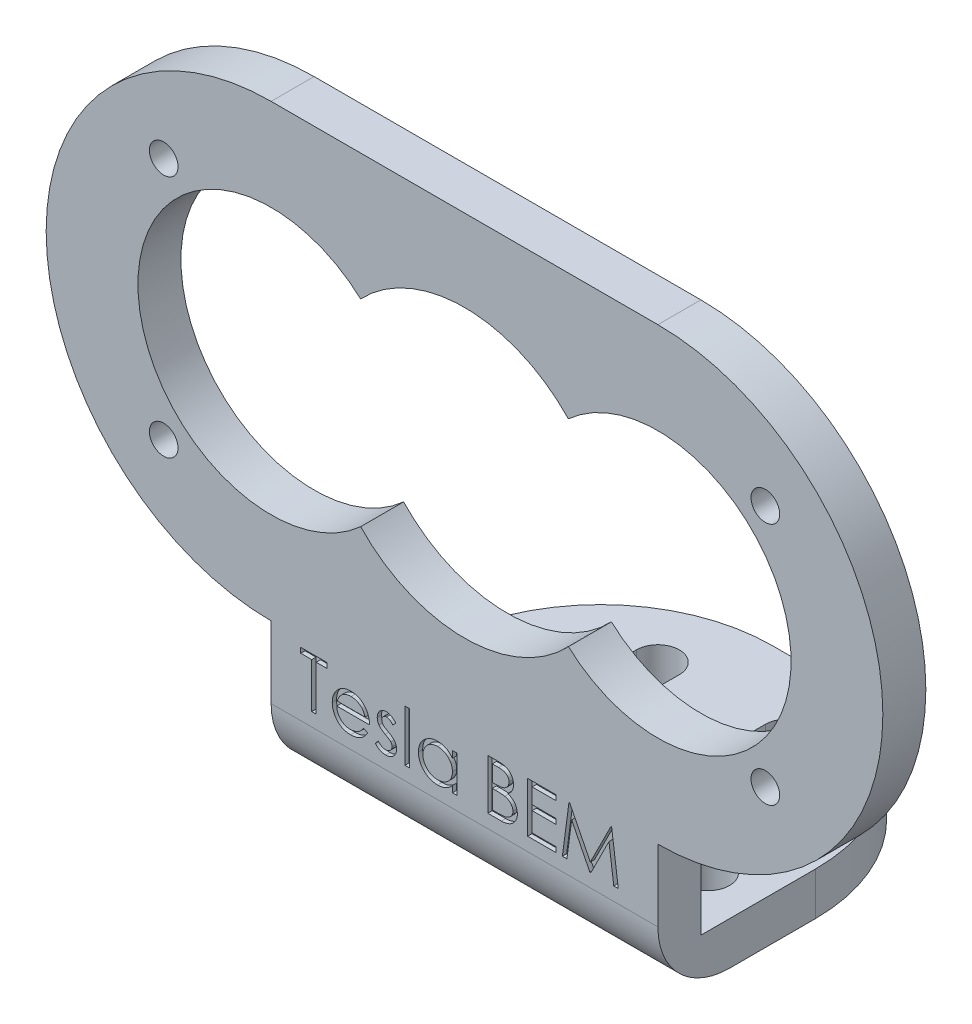
from build123d import *

# Parameters (mm, degrees)
CROQUIS1_R              = 1
SALIENTE_EXTRUIR1_DEPTH = 3
CROQUIS2_W              = 27
CROQUIS2_H              = 3
SALIENTE_EXTRUIR2_DEPTH = 20
REDONDEO1_R             = 12
CROQUIS3_R              = 1.5
CORTAR_EXTRUIR1_DEPTH   = 20
CROQUIS4_W              = 0.314102564
CROQUIS4_H              = 3.589743589
CORTAR_EXTRUIR2_DEPTH   = 0.3
REDONDEO2_R             = 5


with BuildPart() as part:
    # Croquis1 → Saliente-Extruir1 (new body)
    with BuildSketch(Plane.XY):
        with BuildLine():
            Line((0, -15.704277965), (0, -25.704277965))
            Line((0, -25.704277965), (27, -25.704277965))
            Line((27, -25.704277965), (27, -15.704277965))
            ThreePointArc((27, -15.704277965), (42.704277965, 0), (27, 15.704277965))
            Line((27, 15.704277965), (0, 15.704277965))
            ThreePointArc((0, 15.704277965), (-15.704277965, 0), (0, -15.704277965))
        make_face()
        with Locations((-7.5, 8.5)):
            Circle(CROQUIS1_R, mode=Mode.SUBTRACT)
        with Locations((34.5, 8.5)):
            Circle(CROQUIS1_R, mode=Mode.SUBTRACT)
        with Locations((34.5, -8.5)):
            Circle(CROQUIS1_R, mode=Mode.SUBTRACT)
        with Locations((-7.5, -8.5)):
            Circle(CROQUIS1_R, mode=Mode.SUBTRACT)
        with BuildLine():
            ThreePointArc((6.247936352, 6.88531574), (-9.297541691, 0), (6.247936352, -6.88531574))
            ThreePointArc((6.247936352, -6.88531574), (13.5, -10), (20.752063648, -6.88531574))
            ThreePointArc((20.752063648, -6.88531574), (36.297541691, 0), (20.752063648, 6.88531574))
            ThreePointArc((20.752063648, 6.88531574), (13.5, 10), (6.247936352, 6.88531574))
        make_face(mode=Mode.SUBTRACT)
    extrude(amount=SALIENTE_EXTRUIR1_DEPTH)

    # Croquis2 → Saliente-Extruir2 (add)
    with BuildSketch(Plane(origin=(0, 0, 0), x_dir=(-1, 0, 0), z_dir=(0, 0, -1))):
        with Locations((-13.5, -24.204277965)):
            Rectangle(CROQUIS2_W, CROQUIS2_H)
    extrude(amount=SALIENTE_EXTRUIR2_DEPTH)

    # Redondeo1
    redondeo1_edges = [part.edges().sort_by_distance(p)[0] for p in [
        (0, -24.204277965, -20),
        (27, -24.204277965, -20),
    ]]
    fillet(redondeo1_edges, radius=REDONDEO1_R)

    # Croquis3 → Cortar-Extruir1 (cut)
    with BuildSketch(Plane(origin=(0, -22.704277965, 0), x_dir=(1, 0, 0), z_dir=(0, 1, 0))):
        with Locations(Location((3.5, 9, 0), (0, 0, 270))):
            Circle(CROQUIS3_R)
        with Locations(Location((3.5, 4, 0), (0, 0, 270))):
            Circle(CROQUIS3_R)
        with Locations(Location((23.5, 4, 0), (0, 0, 180))):
            Circle(CROQUIS3_R)
        with Locations(Location((23.5, 9, 0), (0, 0, 180))):
            Circle(CROQUIS3_R)
        with BuildLine():
            Line((16.5, 15), (16.5, 3))
            ThreePointArc((16.5, 3), (18, 1.5), (19.5, 3))
            Line((19.5, 3), (19.5, 15))
            ThreePointArc((19.5, 15), (18, 16.5), (16.5, 15))
        make_face()
        with BuildLine():
            Line((7.5, 15), (7.5, 3))
            ThreePointArc((7.5, 3), (9, 1.5), (10.5, 3))
            Line((10.5, 3), (10.5, 15))
            ThreePointArc((10.5, 15), (9, 16.5), (7.5, 15))
        make_face()
    extrude(amount=-CORTAR_EXTRUIR1_DEPTH, mode=Mode.SUBTRACT)

    # Croquis4 → Cortar-Extruir2 (cut)
    # profile 1 of 8: a face of its own
    with BuildSketch(Plane.XY.offset(3)):
        Polygon((2.067796132, -16.628462203), (2.067796132, -16.269487844), (3.907539722, -16.269487844), (3.907539722, -16.628462203), (3.144719209, -16.628462203), (3.144719209, -19.769487844), (2.830616645, -19.769487844), (2.830616645, -16.628462203), align=None)
    # profile 2 of 8: a face of its own
    with BuildSketch(Plane.XY.offset(3)):
        with BuildLine():
            Line((6.455416325, -18.961795537), (6.734462799, -19.108329992))
            add(Edge.make_bspline(
                [(6.734462799, -19.108329992), (6.712226204, -19.147773323), (6.668962595, -19.224514426), (6.594561847, -19.329946286), (6.516569775, -19.424794002), (6.431465807, -19.506523657), (6.341796128, -19.577775042), (6.247063473, -19.640112866), (6.146774655, -19.693231387), (6.040924931, -19.737983915), (5.92862538, -19.772393409), (5.809603863, -19.79669763), (5.683632368, -19.811720898), (5.597286188, -19.813466039), (5.553072575, -19.814359639)],
                knots=[0, 0, 0, 0, 1.120438281, 2.179929193, 3.190490725, 4.156257408, 5.095198341, 6.022838206, 6.959905092, 7.901321166, 8.864066838, 9.862729781, 10.905609505, 12, 12, 12, 12], degree=3))
            add(Edge.make_bspline(
                [(5.553072575, -19.814359639), (5.503930597, -19.813212464), (5.408068836, -19.810974657), (5.268529088, -19.791682193), (5.13714967, -19.760209834), (5.013937967, -19.716244293), (4.899195714, -19.658816969), (4.792694859, -19.588857487), (4.693875333, -19.506725232), (4.605851124, -19.411708789), (4.526607242, -19.310026831), (4.456681422, -19.204070947), (4.398223991, -19.094107722), (4.35067138, -18.980837198), (4.312266515, -18.864973305), (4.285499812, -18.745461837), (4.270070064, -18.622626253), (4.267705618, -18.539528917), (4.266514081, -18.497652909)],
                knots=[0, 0, 0, 0, 1.145258523, 2.234067595, 3.276747158, 4.290159414, 5.277019952, 6.260822364, 7.254936242, 8.264827045, 9.274100331, 10.257902744, 11.220704747, 12.172965371, 13.118907548, 14.062713208, 15.023725156, 16, 16, 16, 16], degree=3))
            add(Edge.make_bspline(
                [(4.266514081, -18.497652909), (4.267573222, -18.458358078), (4.269672301, -18.380480913), (4.282903088, -18.265215369), (4.306351381, -18.153186916), (4.338527705, -18.044302468), (4.380078951, -17.938744334), (4.430911171, -17.836448271), (4.491103548, -17.737523131), (4.537576222, -17.675119997), (4.560985235, -17.643686562)],
                knots=[0, 0, 0, 0, 1.024358464, 2.0301432, 3.019427413, 4.004406732, 4.986367066, 5.972626655, 6.978780325, 8, 8, 8, 8], degree=3))
            add(Edge.make_bspline(
                [(4.560985235, -17.643686562), (4.592692918, -17.605817692), (4.655103864, -17.531279542), (4.76066022, -17.433341216), (4.874960416, -17.351297441), (4.996572042, -17.283290305), (5.126908516, -17.231616658), (5.264217807, -17.193109076), (5.410063394, -17.171531065), (5.509768614, -17.168483231), (5.560784914, -17.166923742)],
                knots=[0, 0, 0, 0, 1.030682036, 2.02871468, 2.997146059, 3.962720338, 4.930598197, 5.918074684, 6.934738563, 8, 8, 8, 8], degree=3))
            add(Edge.make_bspline(
                [(5.560784914, -17.166923742), (5.61323252, -17.168277791), (5.716122766, -17.170934126), (5.866154887, -17.195560459), (6.008115603, -17.234613014), (6.141948108, -17.289766805), (6.267665968, -17.360926356), (6.384452018, -17.449068198), (6.494303531, -17.551486285), (6.558212109, -17.630249494), (6.590732831, -17.670329191)],
                knots=[0, 0, 0, 0, 1.056321875, 2.072262726, 3.055038591, 4.01806755, 4.982017516, 5.957941055, 6.960871419, 8, 8, 8, 8], degree=3))
            add(Edge.make_bspline(
                [(6.590732831, -17.670329191), (6.612859769, -17.700532772), (6.656966363, -17.760738891), (6.712213463, -17.858910048), (6.760170858, -17.961620642), (6.798503819, -18.070530939), (6.82954332, -18.184350519), (6.852000139, -18.303893064), (6.865169757, -18.429122976), (6.867758454, -18.514449531), (6.869078184, -18.557949383)],
                knots=[0, 0, 0, 0, 0.94817472, 1.890038105, 2.849395472, 3.817997239, 4.812318967, 5.836947057, 6.897266129, 8, 8, 8, 8], degree=3))
            Line((6.869078184, -18.557949383), (4.580616645, -18.557949383))
            add(Edge.make_bspline(
                [(4.580616645, -18.557949383), (4.582156252, -18.591649847), (4.585183826, -18.657920451), (4.599298969, -18.754891234), (4.621547743, -18.847264576), (4.652816805, -18.934347618), (4.69068365, -19.017277746), (4.737069367, -19.095439783), (4.792408921, -19.168477713), (4.854134621, -19.23704485), (4.922841716, -19.298105611), (4.995124463, -19.352757388), (5.072018028, -19.398562984), (5.152916112, -19.435742874), (5.237687897, -19.46484919), (5.326360092, -19.484717011), (5.418758208, -19.498024118), (5.481743942, -19.499503783), (5.513809754, -19.500257075)],
                knots=[0, 0, 0, 0, 1.094153842, 2.151609401, 3.174256925, 4.172055639, 5.149267565, 6.128595816, 7.11444997, 8.118368179, 9.117203808, 10.09244225, 11.054858984, 12.015122123, 12.976791628, 13.957293641, 14.960065497, 16, 16, 16, 16], degree=3))
            add(Edge.make_bspline(
                [(5.513809754, -19.500257075), (5.545160902, -19.499649019), (5.607367593, -19.498442518), (5.70000845, -19.486710607), (5.791147978, -19.467740331), (5.880408961, -19.441850341), (5.965979807, -19.410273489), (6.045225357, -19.372170631), (6.118105572, -19.330020884), (6.186222539, -19.281811209), (6.252293532, -19.222803022), (6.317836019, -19.149167301), (6.388112672, -19.062079774), (6.432102265, -18.996534108), (6.455416325, -18.961795537)],
                knots=[0, 0, 0, 0, 0.99110716, 1.966546729, 2.947904876, 3.932708344, 4.903319531, 5.828989031, 6.710028674, 7.56322171, 8.463672341, 9.504779593, 10.677557249, 12, 12, 12, 12], degree=3))
        make_face()
        with BuildLine():
            add(Edge.make_bspline(
                [(6.55497562, -18.243846819), (6.543478995, -18.202183945), (6.521351694, -18.121996325), (6.475115329, -18.010955434), (6.423043788, -17.912267533), (6.361422057, -17.8266879), (6.291603331, -17.750684387), (6.210958149, -17.684265802), (6.120522255, -17.624848351), (6.020763115, -17.574695851), (5.91512133, -17.532005993), (5.804515138, -17.503380877), (5.69165735, -17.483771335), (5.615323063, -17.481945226), (5.576910716, -17.481026306)],
                knots=[0, 0, 0, 0, 1.154881502, 2.222775134, 3.210006277, 4.132804581, 5.035138423, 5.962687519, 6.919655026, 7.923214229, 8.944639381, 9.960483929, 10.97369054, 12, 12, 12, 12], degree=3))
            add(Edge.make_bspline(
                [(5.576910716, -17.481026306), (5.545561277, -17.481637978), (5.483590028, -17.482847124), (5.39228896, -17.494317253), (5.304609261, -17.513277098), (5.219903973, -17.539242054), (5.139283105, -17.573850657), (5.061088337, -17.614433884), (4.987307941, -17.663975467), (4.941166645, -17.701734322), (4.917856229, -17.72080996)],
                knots=[0, 0, 0, 0, 1.04873581, 2.073130211, 3.073294108, 4.04793562, 5.032784715, 6.005352987, 6.992311501, 8, 8, 8, 8], degree=3))
            add(Edge.make_bspline(
                [(4.917856229, -17.72080996), (4.901162947, -17.735904276), (4.867379812, -17.766451492), (4.822239291, -17.819080698), (4.779018818, -17.87583226), (4.739685165, -17.938877385), (4.703607579, -18.007498164), (4.669847602, -18.081115799), (4.63946119, -18.160288929), (4.62236508, -18.215461369), (4.61356937, -18.243846819)],
                knots=[0, 0, 0, 0, 0.879870761, 1.780643979, 2.707998968, 3.669668524, 4.684282772, 5.740141944, 6.837334558, 8, 8, 8, 8], degree=3))
            Line((4.61356937, -18.243846819), (6.55497562, -18.243846819))
        make_face(mode=Mode.SUBTRACT)
    # profile 3 of 8: a face of its own
    with BuildSketch(Plane.XY.offset(3)):
        with BuildLine():
            Line((8.708821773, -17.530805953), (8.495680748, -17.750257075))
            add(Edge.make_bspline(
                [(8.495680748, -17.750257075), (8.477290244, -17.728943929), (8.441835519, -17.687854692), (8.385604038, -17.632917625), (8.329580434, -17.586780686), (8.27453162, -17.547828428), (8.219073351, -17.518379281), (8.163856433, -17.496884419), (8.108823695, -17.483582613), (8.072037659, -17.481868175), (8.053974017, -17.481026306)],
                knots=[0, 0, 0, 0, 1.26578478, 2.440284043, 3.530471711, 4.527705817, 5.468200915, 6.346673037, 7.188140097, 8, 8, 8, 8], degree=3))
            add(Edge.make_bspline(
                [(8.053974017, -17.481026306), (8.031834627, -17.482101179), (7.988267441, -17.484216377), (7.925841623, -17.505329807), (7.867890998, -17.537738546), (7.817734018, -17.583707129), (7.775246338, -17.636471398), (7.744232657, -17.695467723), (7.725266673, -17.758915767), (7.722861941, -17.802945624), (7.721642286, -17.825277107)],
                knots=[0, 0, 0, 0, 0.99966794, 1.967205029, 2.953328237, 3.988086729, 5.028030931, 6.008226631, 6.989793394, 8, 8, 8, 8], degree=3))
            add(Edge.make_bspline(
                [(7.721642286, -17.825277107), (7.722753099, -17.845489151), (7.724971592, -17.885856262), (7.742218271, -17.945404296), (7.769684343, -18.003461334), (7.795354537, -18.039024241), (7.808581389, -18.057348421)],
                knots=[0, 0, 0, 0, 0.960159726, 1.917612774, 2.927026955, 4, 4, 4, 4], degree=3))
            add(Edge.make_bspline(
                [(7.808581389, -18.057348421), (7.816544883, -18.067133006), (7.833494175, -18.08795826), (7.86530269, -18.116862114), (7.901325193, -18.148804365), (7.944645131, -18.180741202), (7.993396159, -18.214372927), (8.048635443, -18.24837506), (8.108609948, -18.285339485), (8.151547255, -18.30878392), (8.173865844, -18.320970216)],
                knots=[0, 0, 0, 0, 0.66740084, 1.420478572, 2.27185888, 3.217733974, 4.268547843, 5.408967954, 6.65319498, 8, 8, 8, 8], degree=3))
            add(Edge.make_bspline(
                [(8.173865844, -18.320970216), (8.201079421, -18.336215119), (8.253647091, -18.365663251), (8.328339858, -18.411372955), (8.396126899, -18.456804379), (8.457582567, -18.501471653), (8.511524376, -18.546624521), (8.559588929, -18.590532278), (8.600577372, -18.634521586), (8.623531299, -18.6652547), (8.634502863, -18.679944575)],
                knots=[0, 0, 0, 0, 1.27191281, 2.456916733, 3.569705269, 4.599008579, 5.553216877, 6.436649441, 7.252746552, 8, 8, 8, 8], degree=3))
            add(Edge.make_bspline(
                [(8.634502863, -18.679944575), (8.652713391, -18.709610663), (8.68895572, -18.768651684), (8.727013986, -18.865870112), (8.749074261, -18.968980614), (8.752136481, -19.039512834), (8.753693568, -19.075377268)],
                knots=[0, 0, 0, 0, 0.995354457, 1.980940102, 2.973342416, 4, 4, 4, 4], degree=3))
            add(Edge.make_bspline(
                [(8.753693568, -19.075377268), (8.752974035, -19.100646414), (8.751556115, -19.150442027), (8.741698048, -19.223776857), (8.724743071, -19.293911414), (8.701649317, -19.361606699), (8.670464944, -19.425565638), (8.633917147, -19.487401887), (8.590042236, -19.545777818), (8.53995086, -19.600616778), (8.485105366, -19.650702526), (8.426599228, -19.69472648), (8.364360397, -19.731300817), (8.298833596, -19.761566162), (8.229869941, -19.78563442), (8.157458652, -19.802296951), (8.081829898, -19.812269712), (8.030400089, -19.813654189), (8.00419437, -19.814359639)],
                knots=[0, 0, 0, 0, 1.032770009, 2.035186124, 3.017557409, 3.978232242, 4.952395191, 5.920591857, 6.910227898, 7.931268572, 8.952309245, 9.941945286, 10.918353717, 11.897095711, 12.887975737, 13.898235213, 14.929059601, 16, 16, 16, 16], degree=3))
            add(Edge.make_bspline(
                [(8.00419437, -19.814359639), (7.968827194, -19.813366939), (7.898584267, -19.811395332), (7.794694548, -19.792889271), (7.693173789, -19.764093877), (7.594790249, -19.724377943), (7.501744135, -19.67422723), (7.416613211, -19.614164836), (7.339101748, -19.546174839), (7.294983474, -19.494061928), (7.272924338, -19.468005473)],
                knots=[0, 0, 0, 0, 1.013940152, 2.01379169, 3.017749504, 4.037548394, 5.051665909, 6.043208538, 7.021604269, 8, 8, 8, 8], degree=3))
            Line((7.272924338, -19.468005473), (7.481157511, -19.231026306))
            add(Edge.make_bspline(
                [(7.481157511, -19.231026306), (7.500929924, -19.252381071), (7.539261736, -19.293780511), (7.600562953, -19.348904851), (7.662942354, -19.395106122), (7.72577704, -19.433749537), (7.789997135, -19.46352494), (7.855242749, -19.484443534), (7.921381173, -19.497887726), (7.965803309, -19.499466009), (7.988068568, -19.500257075)],
                knots=[0, 0, 0, 0, 1.179806542, 2.287233372, 3.337373186, 4.324005949, 5.273901747, 6.200048787, 7.097828587, 8, 8, 8, 8], degree=3))
            add(Edge.make_bspline(
                [(7.988068568, -19.500257075), (8.018386494, -19.49888625), (8.077622636, -19.496207889), (8.162466395, -19.471890797), (8.240805021, -19.433760845), (8.308828366, -19.379676147), (8.366730528, -19.316720574), (8.408658702, -19.245806455), (8.434934877, -19.169014998), (8.438020876, -19.115782695), (8.439591004, -19.088698582)],
                knots=[0, 0, 0, 0, 1.072336372, 2.095165389, 3.102688358, 4.141489647, 5.156069229, 6.117746104, 7.042326257, 8, 8, 8, 8], degree=3))
            add(Edge.make_bspline(
                [(8.439591004, -19.088698582), (8.43850471, -19.066388963), (8.436359967, -19.022341607), (8.419516695, -18.958591266), (8.392903843, -18.898121986), (8.366699195, -18.862732338), (8.353353023, -18.844708197)],
                knots=[0, 0, 0, 0, 1.013901739, 2.00181326, 2.98231254, 4, 4, 4, 4], degree=3))
            add(Edge.make_bspline(
                [(8.353353023, -18.844708197), (8.345330629, -18.835672835), (8.327854957, -18.815990553), (8.295799715, -18.787565474), (8.257417853, -18.756927375), (8.21227769, -18.724595786), (8.160288228, -18.690997181), (8.101238753, -18.656307828), (8.0359382, -18.618880103), (7.989767569, -18.594060447), (7.965632671, -18.581086402)],
                knots=[0, 0, 0, 0, 0.615000592, 1.339693406, 2.178160186, 3.116406724, 4.166410947, 5.330106347, 6.604359322, 8, 8, 8, 8], degree=3))
            add(Edge.make_bspline(
                [(7.965632671, -18.581086402), (7.939586031, -18.566547271), (7.889073283, -18.538351254), (7.817525992, -18.494435174), (7.752978638, -18.449767899), (7.693878064, -18.40685506), (7.641717058, -18.363434116), (7.59670111, -18.319456865), (7.557057894, -18.276696879), (7.535110482, -18.246399582), (7.524627062, -18.231927748)],
                knots=[0, 0, 0, 0, 1.262093308, 2.447601706, 3.550203992, 4.582594899, 5.537233252, 6.418365656, 7.244515135, 8, 8, 8, 8], degree=3))
            add(Edge.make_bspline(
                [(7.524627062, -18.231927748), (7.506496462, -18.202782133), (7.470228927, -18.144480718), (7.435013736, -18.047170241), (7.410807707, -17.944725184), (7.408645317, -17.87403833), (7.407539722, -17.8378973)],
                knots=[0, 0, 0, 0, 0.985009483, 1.970363186, 2.962279964, 4, 4, 4, 4], degree=3))
            add(Edge.make_bspline(
                [(7.407539722, -17.8378973), (7.408073918, -17.814271902), (7.409119413, -17.768033651), (7.417463465, -17.70009483), (7.432655176, -17.635546677), (7.451710099, -17.573419814), (7.478193103, -17.514917719), (7.509839008, -17.459260248), (7.547026433, -17.40652433), (7.589869724, -17.357521198), (7.636976369, -17.313011872), (7.687871139, -17.274213244), (7.741409396, -17.241106889), (7.797817815, -17.213341729), (7.857638288, -17.192340346), (7.920452675, -17.177882961), (7.986133829, -17.168227758), (8.031034955, -17.167364674), (8.053974017, -17.166923742)],
                knots=[0, 0, 0, 0, 1.087655834, 2.128696564, 3.144119009, 4.137814668, 5.115653402, 6.093965665, 7.082169637, 8.081268856, 9.086088321, 10.061021666, 11.022561449, 11.980240094, 12.950172527, 13.934149372, 14.944599409, 16, 16, 16, 16], degree=3))
            add(Edge.make_bspline(
                [(8.053974017, -17.166923742), (8.081166081, -17.168028083), (8.136060302, -17.17025748), (8.218414928, -17.187963171), (8.30064827, -17.217096275), (8.38297162, -17.257332508), (8.46478191, -17.309399384), (8.546798767, -17.372328684), (8.630006797, -17.445706398), (8.68196311, -17.501805624), (8.708821773, -17.530805953)],
                knots=[0, 0, 0, 0, 0.845714091, 1.707292901, 2.609013841, 3.555613372, 4.552488639, 5.621697636, 6.770543573, 8, 8, 8, 8], degree=3))
        make_face()
    # profile 4 of 8: a face of its own
    with BuildSketch(Plane.XY.offset(3)):
        with Locations((9.494078184, -17.974616049)):
            Rectangle(CROQUIS4_W, CROQUIS4_H)
    # profile 5 of 8: a face of its own
    with BuildSketch(Plane.XY.offset(3)):
        with BuildLine():
            Line((12.971642286, -17.211795537), (12.971642286, -19.769487844))
            Line((12.971642286, -19.769487844), (12.657539722, -19.769487844))
            Line((12.657539722, -19.769487844), (12.657539722, -19.327079992))
            add(Edge.make_bspline(
                [(12.657539722, -19.327079992), (12.622120932, -19.367119586), (12.553000716, -19.445257357), (12.437559598, -19.547339529), (12.31519142, -19.631717851), (12.186490099, -19.699867767), (12.051571856, -19.751059823), (11.910735769, -19.787445982), (11.763924388, -19.810839817), (11.663672033, -19.813175839), (11.612868248, -19.814359639)],
                knots=[0, 0, 0, 0, 1.074387032, 2.096679803, 3.090159297, 4.057316773, 5.018401886, 5.985159533, 6.978961417, 8, 8, 8, 8], degree=3))
            add(Edge.make_bspline(
                [(11.612868248, -19.814359639), (11.567700294, -19.813133267), (11.478627089, -19.810714807), (11.347598012, -19.791952503), (11.221505763, -19.761821881), (11.10023119, -19.719920992), (10.984559044, -19.66434017), (10.873498948, -19.597798922), (10.767626256, -19.518558092), (10.668554717, -19.427970064), (10.577322716, -19.329575077), (10.497261444, -19.22462953), (10.430508364, -19.113587226), (10.374688283, -18.997854072), (10.331691939, -18.876539152), (10.301718305, -18.750061984), (10.282977858, -18.618572111), (10.280560397, -18.529032588), (10.279334594, -18.483630473)],
                knots=[0, 0, 0, 0, 1.033919861, 2.038935746, 3.024066025, 3.998881131, 4.97069526, 5.957263378, 6.95902576, 7.993208707, 9.027059324, 10.027763471, 11.009749337, 11.988697705, 12.965288445, 13.950418724, 14.960734635, 16, 16, 16, 16], degree=3))
            add(Edge.make_bspline(
                [(10.279334594, -18.483630473), (10.280587565, -18.439166769), (10.283064622, -18.351264426), (10.301517842, -18.221985728), (10.332548851, -18.097467467), (10.376096698, -17.978110524), (10.431938653, -17.863770474), (10.49986674, -17.754366449), (10.579885865, -17.649597051), (10.672138272, -17.551925824), (10.772073042, -17.46170521), (10.878981773, -17.383296165), (10.990205054, -17.315579316), (11.107468065, -17.26192584), (11.22903517, -17.218516735), (11.355988616, -17.188483767), (11.487800194, -17.170786446), (11.577290686, -17.168223682), (11.622683953, -17.166923742)],
                knots=[0, 0, 0, 0, 1.020392517, 2.01726096, 2.990465484, 3.961182959, 4.928053699, 5.906110375, 6.912531644, 7.948652711, 8.985773172, 9.998621852, 10.987621588, 11.969261332, 12.953316658, 13.946091881, 14.958173133, 16, 16, 16, 16], degree=3))
            add(Edge.make_bspline(
                [(11.622683953, -17.166923742), (11.674883812, -17.168361493), (11.777245272, -17.171180856), (11.926973281, -17.194643584), (12.068617759, -17.234282051), (12.203272111, -17.288199549), (12.330452797, -17.359848278), (12.448955782, -17.450228239), (12.560021265, -17.558769426), (12.624401557, -17.64213987), (12.657539722, -17.685052748)],
                knots=[0, 0, 0, 0, 1.038897134, 2.037228247, 3.008116434, 3.962042015, 4.918381754, 5.904844433, 6.921570401, 8, 8, 8, 8], degree=3))
            Line((12.657539722, -17.685052748), (12.657539722, -17.211795537))
            Line((12.657539722, -17.211795537), (12.971642286, -17.211795537))
        make_face()
        with BuildLine():
            add(Edge.make_bspline(
                [(11.626890684, -17.481026306), (11.580976346, -17.482659944), (11.490348746, -17.485884485), (11.357304744, -17.51105798), (11.22999133, -17.552942574), (11.109045255, -17.610224476), (10.996377039, -17.682253212), (10.895683368, -17.769374595), (10.806140667, -17.86921161), (10.730832402, -17.98131372), (10.669441906, -18.101491811), (10.626274874, -18.227116249), (10.597805626, -18.355921227), (10.594897106, -18.443283912), (10.593437158, -18.487136082)],
                knots=[0, 0, 0, 0, 1.031046209, 2.035121221, 3.029706178, 4.034933723, 5.034054252, 6.02443088, 7.017295772, 8.038157696, 9.050218397, 10.03989886, 11.016116709, 12, 12, 12, 12], degree=3))
            add(Edge.make_bspline(
                [(10.593437158, -18.487136082), (10.595302051, -18.530726189), (10.599024528, -18.617735545), (10.625775223, -18.746716121), (10.670655096, -18.872370164), (10.731897159, -18.993631157), (10.808583784, -19.106215257), (10.897472436, -19.20795538), (10.999422717, -19.295444968), (11.112350224, -19.368682542), (11.232958195, -19.427845063), (11.359792126, -19.469010702), (11.490467765, -19.495588483), (11.579320098, -19.49869296), (11.624086197, -19.500257075)],
                knots=[0, 0, 0, 0, 0.979072187, 1.954306742, 2.945804271, 3.96968567, 4.997920485, 5.998718438, 6.996577872, 8.005894225, 9.015743152, 10.005417472, 10.995077863, 12, 12, 12, 12], degree=3))
            add(Edge.make_bspline(
                [(11.624086197, -19.500257075), (11.669532699, -19.498597111), (11.759921286, -19.495295608), (11.893359994, -19.470014342), (12.022854957, -19.428245544), (12.146642185, -19.370346417), (12.261958316, -19.298589061), (12.365456194, -19.21458197), (12.452972162, -19.116878786), (12.527164772, -19.009502333), (12.585340188, -18.891790337), (12.627716248, -18.766456146), (12.652770153, -18.633495398), (12.655927883, -18.542631471), (12.657539722, -18.496250665)],
                knots=[0, 0, 0, 0, 1.01762866, 2.023962475, 3.030623092, 4.058876274, 5.077231937, 6.066672613, 7.034107872, 8.005628644, 8.981990164, 9.965428785, 10.961468474, 12, 12, 12, 12], degree=3))
            add(Edge.make_bspline(
                [(12.657539722, -18.496250665), (12.656580066, -18.460912834), (12.654691158, -18.391356801), (12.640260589, -18.289229284), (12.617305662, -18.191495558), (12.584959492, -18.098052868), (12.542468208, -18.009417853), (12.491220442, -17.924954093), (12.430314992, -17.845100881), (12.360732296, -17.770957811), (12.284567094, -17.703331348), (12.203972553, -17.642967108), (12.117993806, -17.593378335), (12.028076769, -17.552337063), (11.934065435, -17.519677913), (11.835194815, -17.49789022), (11.732515828, -17.482929899), (11.662469773, -17.481667518), (11.626890684, -17.481026306)],
                knots=[0, 0, 0, 0, 1.050140795, 2.067009409, 3.05949893, 4.030605086, 5.00011959, 5.97591094, 6.962425594, 7.979863591, 8.993523472, 9.986985069, 10.967611495, 11.937549037, 12.921786183, 13.919465291, 14.943216303, 16, 16, 16, 16], degree=3))
        make_face(mode=Mode.SUBTRACT)
    # profile 6 of 8: a face of its own
    with BuildSketch(Plane.XY.offset(3)):
        with BuildLine():
            Line((15.12548844, -16.269487844), (15.808381068, -16.269487844))
            add(Edge.make_bspline(
                [(15.808381068, -16.269487844), (15.841809547, -16.269663595), (15.906602257, -16.270004243), (16.000821699, -16.275287374), (16.089070509, -16.282491044), (16.171374282, -16.293921137), (16.247694984, -16.307712914), (16.318262621, -16.32441473), (16.382852794, -16.344441343), (16.45996553, -16.376287625), (16.547886191, -16.423610793), (16.643084584, -16.493539358), (16.724488823, -16.579071821), (16.79467514, -16.675554477), (16.85047626, -16.781690249), (16.890845557, -16.894949437), (16.916403432, -17.013871179), (16.919031867, -17.095514357), (16.920360235, -17.136775505)],
                knots=[0, 0, 0, 0, 1.001505555, 1.941167018, 2.826882275, 3.653841531, 4.429895133, 5.150066043, 5.825578002, 6.45369114, 7.647487171, 8.808567382, 9.977351308, 11.170798116, 12.373658725, 13.556498008, 14.765093433, 16, 16, 16, 16], degree=3))
            add(Edge.make_bspline(
                [(16.920360235, -17.136775505), (16.919267017, -17.17542806), (16.917118739, -17.251383977), (16.89657598, -17.362478087), (16.864415311, -17.468229306), (16.819710062, -17.568251691), (16.761608066, -17.660285304), (16.692749747, -17.74507257), (16.609672945, -17.819023627), (16.547429705, -17.86036653), (16.515812959, -17.881366851)],
                knots=[0, 0, 0, 0, 1.044552857, 2.05264487, 3.044412934, 4.028983338, 5.005914585, 5.980388656, 6.974128949, 8, 8, 8, 8], degree=3))
            add(Edge.make_bspline(
                [(16.515812959, -17.881366851), (16.555573387, -17.89663185), (16.631644934, -17.925837574), (16.736330947, -17.977473038), (16.826525792, -18.033635149), (16.902922938, -18.094966999), (16.968260593, -18.16107581), (17.025313534, -18.232930924), (17.073994908, -18.311469682), (17.115707832, -18.395873217), (17.148256588, -18.485279685), (17.172632492, -18.578850462), (17.186599942, -18.676250017), (17.188587583, -18.742535396), (17.189591004, -18.775998261)],
                knots=[0, 0, 0, 0, 1.27268992, 2.434971085, 3.483601985, 4.442670788, 5.356604649, 6.2567628, 7.179492994, 8.113709626, 9.066344395, 10.018646069, 10.999752585, 12, 12, 12, 12], degree=3))
            add(Edge.make_bspline(
                [(17.189591004, -18.775998261), (17.188614158, -18.810165133), (17.186692186, -18.877389411), (17.172512215, -18.976144546), (17.148503108, -19.070519493), (17.115431961, -19.161124675), (17.072269647, -19.24778481), (17.019741682, -19.330598074), (16.957110119, -19.408732404), (16.88704725, -19.483056027), (16.807785104, -19.549883815), (16.722269349, -19.609399521), (16.629423029, -19.658345584), (16.530771035, -19.699461605), (16.425206719, -19.730868804), (16.313204112, -19.752841377), (16.19485981, -19.767646414), (16.113650059, -19.768863619), (16.072002863, -19.769487844)],
                knots=[0, 0, 0, 0, 0.978564426, 1.925352924, 2.850884081, 3.763762016, 4.682927383, 5.618979971, 6.567305752, 7.547517671, 8.540179244, 9.531824382, 10.526200242, 11.540722885, 12.589160233, 13.674978461, 14.80764778, 16, 16, 16, 16], degree=3))
            Line((16.072002863, -19.769487844), (15.12548844, -19.769487844))
            Line((15.12548844, -19.769487844), (15.12548844, -16.269487844))
        make_face()
        with BuildLine():
            Line((15.439591004, -16.628462203), (15.439591004, -17.750257075))
            Line((15.439591004, -17.750257075), (15.650628664, -17.750257075))
            add(Edge.make_bspline(
                [(15.650628664, -17.750257075), (15.68147746, -17.749857152), (15.741083619, -17.74908442), (15.827403516, -17.746870902), (15.907528534, -17.740672859), (15.981320367, -17.734476597), (16.048662811, -17.724402009), (16.109406672, -17.712409886), (16.164505269, -17.699726981), (16.228044815, -17.678157494), (16.300117763, -17.646279819), (16.376950868, -17.596807983), (16.444685337, -17.53788363), (16.501882525, -17.469892668), (16.548693995, -17.395026482), (16.58120771, -17.314479602), (16.603254995, -17.23025947), (16.605246526, -17.172441217), (16.606257671, -17.143085601)],
                knots=[0, 0, 0, 0, 1.156816544, 2.235205308, 3.236616184, 4.169592532, 5.011045266, 5.787822928, 6.49130361, 7.128639758, 8.301311294, 9.436451833, 10.541879658, 11.654887649, 12.756523258, 13.837046038, 14.901820046, 16, 16, 16, 16], degree=3))
            add(Edge.make_bspline(
                [(16.606257671, -17.143085601), (16.605731491, -17.123659829), (16.604699331, -17.085554057), (16.596246028, -17.030004703), (16.581878454, -16.977760951), (16.563424161, -16.92810684), (16.537635472, -16.88259499), (16.507272009, -16.839651794), (16.470586318, -16.800739676), (16.428829006, -16.764370178), (16.380820383, -16.73212565), (16.326589091, -16.703884887), (16.265401414, -16.68114411), (16.198288559, -16.661227957), (16.124217471, -16.647239664), (16.044042918, -16.635586276), (15.957108199, -16.629653534), (15.896963096, -16.628868171), (15.865873056, -16.628462203)],
                knots=[0, 0, 0, 0, 0.91205012, 1.789085906, 2.630437955, 3.453916878, 4.269457761, 5.079663411, 5.91843418, 6.774407191, 7.675494373, 8.627863946, 9.638891023, 10.736472738, 11.911756761, 13.175263542, 14.539845004, 16, 16, 16, 16], degree=3))
            Line((15.865873056, -16.628462203), (15.439591004, -16.628462203))
        make_face(mode=Mode.SUBTRACT)
        with BuildLine():
            Line((15.439591004, -18.109231434), (15.439591004, -19.410513486))
            Line((15.439591004, -19.410513486), (15.886906709, -19.410513486))
            add(Edge.make_bspline(
                [(15.886906709, -19.410513486), (15.918925635, -19.410129738), (15.980637894, -19.409390116), (16.069739124, -19.406975561), (16.152322228, -19.401483285), (16.228010364, -19.392837436), (16.297620816, -19.383458987), (16.360318519, -19.370847706), (16.416611713, -19.356398745), (16.48188602, -19.334064573), (16.555389529, -19.299368102), (16.634600385, -19.247053875), (16.705026603, -19.184730568), (16.764831862, -19.112599654), (16.813844851, -19.034168327), (16.849500306, -18.951022977), (16.871491163, -18.864537449), (16.874153332, -18.805570737), (16.87548844, -18.775998261)],
                knots=[0, 0, 0, 0, 1.160039823, 2.235823828, 3.228722157, 4.157150951, 4.99529583, 5.772374946, 6.472645482, 7.099169577, 8.269452708, 9.405989375, 10.527446681, 11.663510218, 12.788923519, 13.866172445, 14.929861265, 16, 16, 16, 16], degree=3))
            add(Edge.make_bspline(
                [(16.87548844, -18.775998261), (16.875212336, -18.757504921), (16.874664581, -18.720816539), (16.866403966, -18.66690072), (16.854390096, -18.614674846), (16.838858662, -18.563997106), (16.816239195, -18.51578373), (16.78983265, -18.46908117), (16.758871248, -18.423827691), (16.710627082, -18.366615437), (16.640455098, -18.300698424), (16.540748323, -18.236160922), (16.427376025, -18.184113115), (16.345148532, -18.162013639), (16.302671934, -18.15059762)],
                knots=[0, 0, 0, 0, 0.723448775, 1.435228256, 2.130040452, 2.821711965, 3.505591119, 4.210454504, 4.921174351, 5.648778258, 7.137944449, 8.670945889, 10.280296675, 12, 12, 12, 12], degree=3))
            add(Edge.make_bspline(
                [(16.302671934, -18.15059762), (16.285642838, -18.147142536), (16.248720246, -18.139651201), (16.188512665, -18.131743498), (16.119776796, -18.124698438), (16.042353919, -18.119487281), (15.956146078, -18.114100737), (15.860969159, -18.112005916), (15.757211845, -18.109506656), (15.685219472, -18.109325522), (15.647824177, -18.109231434)],
                knots=[0, 0, 0, 0, 0.634451884, 1.375622551, 2.216452059, 3.157844607, 4.20941857, 5.370758133, 6.634282058, 8, 8, 8, 8], degree=3))
            Line((15.647824177, -18.109231434), (15.439591004, -18.109231434))
        make_face(mode=Mode.SUBTRACT)
    # profile 7 of 8: a face of its own
    with BuildSketch(Plane.XY.offset(3)):
        Polygon((17.907539722, -16.269487844), (19.881898697, -16.269487844), (19.881898697, -16.628462203), (18.221642286, -16.628462203), (18.221642286, -17.70538528), (19.881898697, -17.70538528), (19.881898697, -18.064359639), (18.221642286, -18.064359639), (18.221642286, -19.410513486), (19.881898697, -19.410513486), (19.881898697, -19.769487844), (17.907539722, -19.769487844), align=None)
    # profile 8 of 8: a face of its own
    with BuildSketch(Plane.XY.offset(3)):
        Polygon((20.330616645, -19.769487844), (20.792655908, -16.269487844), (20.837527703, -16.269487844), (22.282539722, -19.141282716), (23.724046132, -16.269487844), (23.769619049, -16.269487844), (24.234462799, -19.769487844), (23.918957991, -19.769487844), (23.583821773, -17.251058357), (22.320400299, -19.769487844), (22.249586998, -19.769487844), (20.981257671, -17.245449383), (20.646822575, -19.769487844), align=None)
    extrude(amount=-CORTAR_EXTRUIR2_DEPTH, mode=Mode.SUBTRACT)

    # Redondeo2
    # the kernel refuses this fillet: 5 mm, written as the material it takes off along each edge
    with BuildSketch(Plane(origin=(-12.5, -25.704277965, 3), x_dir=(0, 0, -1), z_dir=(1, 0, 0))) as redondeo2_piece_1:
        with BuildLine():
            CenterArc((REDONDEO2_R, REDONDEO2_R), REDONDEO2_R, 180, 90)
            Line((0, REDONDEO2_R), (0, 0))
            Line((0, 0), (REDONDEO2_R, 0))
        make_face()
    extrude(amount=52, mode=Mode.SUBTRACT)


solid = part.part
